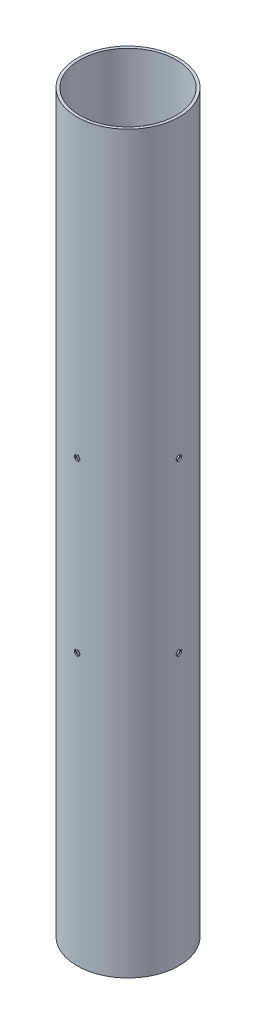
from build123d import *

# Parameters (mm, degrees)
SKETCH1_R            = 53.721
SKETCH1_R_2          = 50.8
TUBE_EXTRUSION_DEPTH = 774.7
BULKHEAD_HOLES_REACH = 785.958
SKETCH3_R            = 1.6383
HOLE_PATTERN_COUNT   = 4
SKETCH4_R            = 2.9083
SKETCH4_R_2          = 1.6383
CUT_EXTRUDE1_DEPTH   = 1.27
CIRPATTERN1_COUNT    = 4


with BuildPart() as part:
    # Sketch1 → Tube Extrusion (new body)
    with BuildSketch(Plane(origin=(0, 0, 0), x_dir=(1, 0, 0), z_dir=(0, 1, 0))):
        Circle(SKETCH1_R)
        Circle(SKETCH1_R_2, mode=Mode.SUBTRACT)
    extrude(amount=TUBE_EXTRUSION_DEPTH)

    # Sketch3 → Bulkhead Holes (cut, up to next)
    with BuildSketch(Plane.XY.offset(53.721), mode=Mode.PRIVATE) as bulkhead_holes_sk1:
        with Locations((0, 463.55)):
            Circle(SKETCH3_R)
    bulkhead_holes_tool1 = extrude(bulkhead_holes_sk1.sketch, amount=-BULKHEAD_HOLES_REACH, mode=Mode.PRIVATE) & part.part
    # Sketch3 → Bulkhead Holes (cut, up to next)
    with BuildSketch(Plane.XY.offset(53.721), mode=Mode.PRIVATE) as bulkhead_holes_sk2:
        with Locations((0, 285.75)):
            Circle(SKETCH3_R)
    bulkhead_holes_tool2 = extrude(bulkhead_holes_sk2.sketch, amount=-BULKHEAD_HOLES_REACH, mode=Mode.PRIVATE) & part.part
    bulkhead_holes_1 = bulkhead_holes_tool1.solids().sort_by_distance((0, 463.55, 53.721))[0]
    add(bulkhead_holes_1, mode=Mode.SUBTRACT)
    bulkhead_holes_2 = bulkhead_holes_tool2.solids().sort_by_distance((0, 285.75, 53.721))[0]
    add(bulkhead_holes_2, mode=Mode.SUBTRACT)
    bulkhead_holes = bulkhead_holes_1 + bulkhead_holes_2  # Bulkhead Holes as one shape, for the pattern or mirror that repeats it

    # Hole Pattern: Bulkhead Holes ×4 about axis
    hole_pattern_axis = Axis((0, 774.7, 0), (0, -1, 0))
    for i in range(1, HOLE_PATTERN_COUNT):
        add(bulkhead_holes.rotate(hole_pattern_axis, i * 360 / HOLE_PATTERN_COUNT), mode=Mode.SUBTRACT)

    # Sketch4 → Cut-Extrude1 (cut)
    # profile 1 of 2: a face of its own
    with BuildSketch(Plane.XY.offset(53.721)):
        with Locations((0, 463.55)):
            Circle(SKETCH4_R)
        with Locations((0, 463.55)):
            Circle(SKETCH4_R_2, mode=Mode.SUBTRACT)
    # profile 2 of 2: a face of its own
    with BuildSketch(Plane.XY.offset(53.721)):
        with Locations((0, 285.75)):
            Circle(SKETCH4_R)
        with Locations((0, 285.75)):
            Circle(SKETCH4_R_2, mode=Mode.SUBTRACT)
    cut_extrude1 = extrude(amount=-CUT_EXTRUDE1_DEPTH, mode=Mode.SUBTRACT)

    # CirPattern1: Cut-Extrude1 ×4 about axis
    cirpattern1_axis = Axis((0, 774.7, 0), (0, -1, 0))
    for i in range(1, CIRPATTERN1_COUNT):
        add(cut_extrude1.rotate(cirpattern1_axis, i * 360 / CIRPATTERN1_COUNT), mode=Mode.SUBTRACT)


solid = part.part
